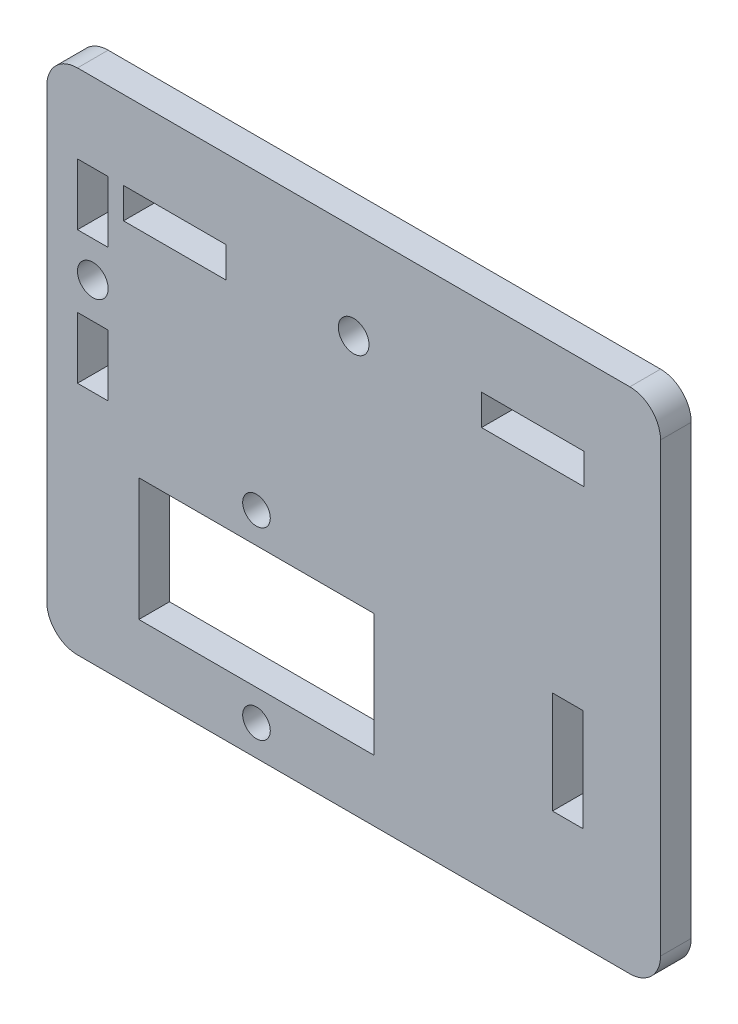
from build123d import *

# Parameters (mm, degrees)
MODEL_R             = 1.35
MODEL_W             = 3
MODEL_H             = 10
MODEL_R_2           = 1.500000003
MODEL_R_3           = 1.500000002
BOSS_EXTRUDE1_DEPTH = 3


with BuildPart() as part:
    # Model → Boss-Extrude1 (new body)
    with BuildSketch(Plane.XY):
        with BuildLine():
            Line((77.350321433, 18.147891946), (77.350374728, 38.932799758))
            Line((77.350374728, 38.932799758), (77.3504385, 61.847914879))
            ThreePointArc((77.3504385, 61.847914879), (76.471798677, 63.969197152), (74.350545547, 64.84790733))
            Line((74.350545547, 64.84790733), (73.850545547, 64.84790733))
            Line((73.850545547, 64.84790733), (20.350545547, 64.848184253))
            ThreePointArc((20.350545547, 64.848184253), (18.229231749, 63.96968584), (17.350530152, 61.848456197))
            Line((17.350530152, 61.848456197), (17.350515858, 58.851148101))
            Line((17.350515858, 58.851148101), (17.350325984, 19.035510771))
            Line((17.350325984, 19.035510771), (17.350321434, 18.148199638))
            ThreePointArc((17.350321434, 18.148199638), (18.228860554, 16.026745133), (20.350306049, 15.148184254))
            Line((20.350306049, 15.148184254), (32.850606049, 15.14812015))
            Line((32.850606049, 15.14812015), (74.350306048, 15.147907331))
            ThreePointArc((74.350306048, 15.147907331), (76.471660555, 16.026546451), (77.350321433, 18.147891946))
        make_face()
        with Locations((37.850318867, 18.148094512)):
            Circle(MODEL_R, mode=Mode.SUBTRACT)
        Polygon((49.350398356, 33.148035536), (49.350336818, 21.148035536), (26.350336818, 21.148153485), (26.350398357, 33.148153484), align=None, mode=Mode.SUBTRACT)
        with Locations((37.850416303, 36.148094512)):
            Circle(MODEL_R, mode=Mode.SUBTRACT)
        with Locations((68.28527947, 30.147930167)):
            Rectangle(MODEL_W, MODEL_H, mode=Mode.SUBTRACT)
        Polygon((20.350454767, 44.148184254), (23.350454767, 44.148168869), (23.350423998, 38.148168869), (20.350423998, 38.148184254), align=None, mode=Mode.SUBTRACT)
        with Locations((21.850472716, 47.648176561)):
            Circle(MODEL_R_2, mode=Mode.SUBTRACT)
        Polygon((20.350521434, 57.148184253), (23.350521434, 57.148168869), (23.350490665, 51.148168869), (20.350490665, 51.148184253), align=None, mode=Mode.SUBTRACT)
        Polygon((34.850521434, 57.148109894), (34.850506049, 54.148109894), (24.850506049, 54.148161176), (24.850521434, 57.148161176), align=None, mode=Mode.SUBTRACT)
        with Locations((47.350513739, 55.648045793)):
            Circle(MODEL_R_3, mode=Mode.SUBTRACT)
        Polygon((69.850521433, 57.147930167), (69.850505905, 54.147930167), (59.850505905, 54.147930167), (59.850505905, 57.147981929), align=None, mode=Mode.SUBTRACT)
    extrude(amount=BOSS_EXTRUDE1_DEPTH)


solid = part.part
